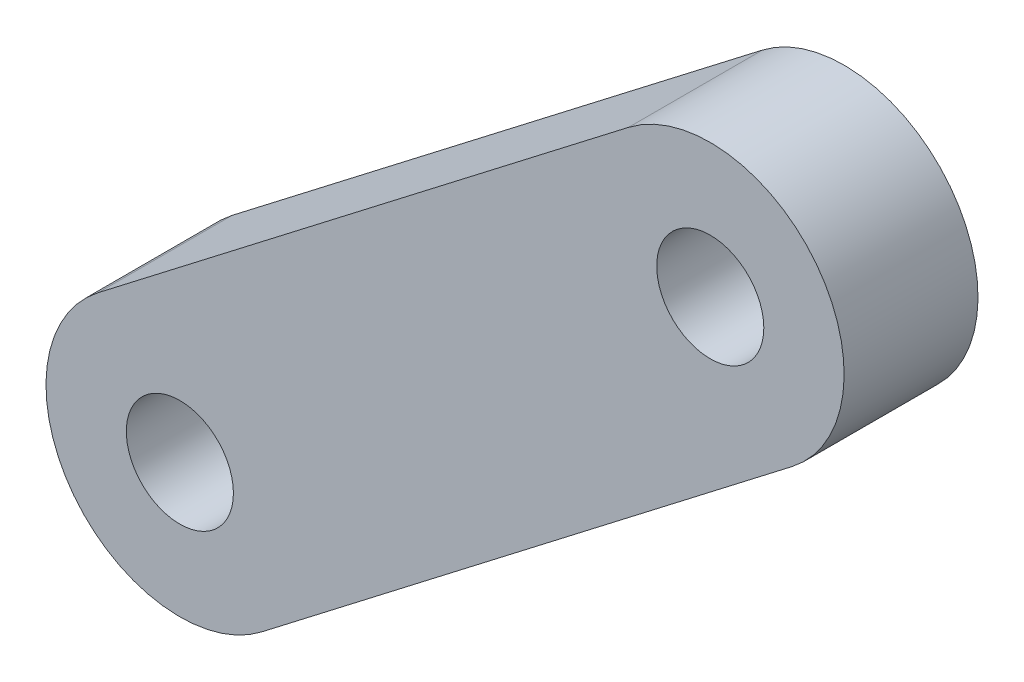
from build123d import *

# Parameters (mm, degrees)
SKETCH1_R           = 2
BOSS_EXTRUDE1_DEPTH = 5


with BuildPart() as part:
    # Sketch1 → Boss-Extrude1 (new body)
    with BuildSketch(Plane(origin=(0, 0, 0), x_dir=(0.9997573026985189, -0.022030335925312537, 0), z_dir=(0, 0, 1))):
        with BuildLine():
            Line((-29.904437649, 103.275259833), (-49.372163993, 87.590629426))
            ThreePointArc((-49.372163993, 87.590629426), (-50.12878318, 80.560158076), (-43.09831183, 79.803538889))
            Line((-43.09831183, 79.803538889), (-23.630585486, 95.488169295))
            ThreePointArc((-23.630585486, 95.488169295), (-23.225758684, 95.852410595), (-22.86294507, 96.25851741))
            ThreePointArc((-22.86294507, 96.25851741), (-23.238207598, 102.923467448), (-29.904437649, 103.275259833))
        make_face()
        with Locations((-46.235237911, 83.697084158)):
            Circle(SKETCH1_R, mode=Mode.SUBTRACT)
        with Locations((-26.767511567, 99.381714564)):
            Circle(SKETCH1_R, mode=Mode.SUBTRACT)
    extrude(amount=BOSS_EXTRUDE1_DEPTH)


solid = part.part
